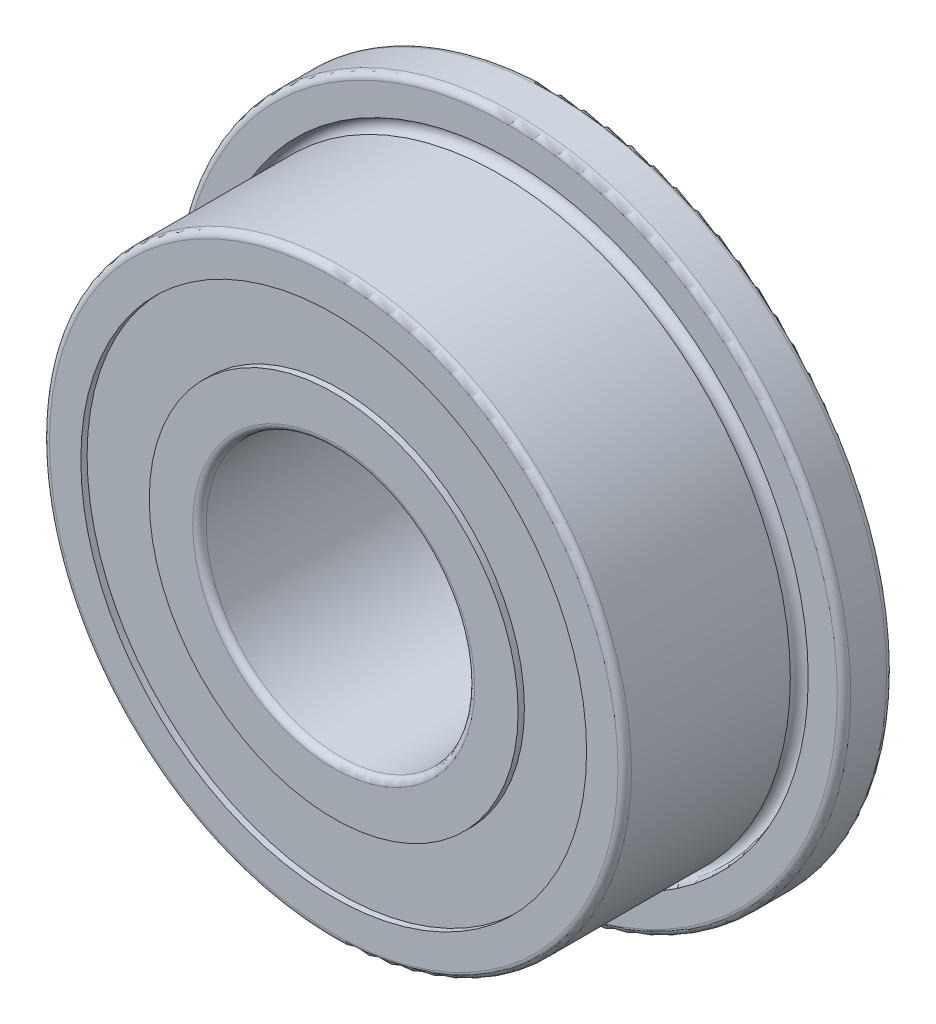
from build123d import *


with BuildPart() as part:
    # Esquisse1 → Révolution1 (revolve)
    with BuildSketch(Plane(origin=(0, 0, 0), x_dir=(0, 0, -1), z_dir=(1, 0, 0))):
        with BuildLine():
            Line((0, 6.35), (0, 5.649))
            Line((0, 5.649), (0.14, 5.649))
            Line((0.14, 5.649), (0.14, 4.12))
            Line((0.14, 4.12), (0, 4.12))
            Line((0, 4.12), (0, 3.15))
            ThreePointArc((0, 3.15), (0.043933983, 3.043933983), (0.15, 3))
            Line((0.15, 3), (4.85, 3))
            ThreePointArc((4.85, 3), (4.956066017, 3.043933983), (5, 3.15))
            Line((5, 3.15), (5, 4.12))
            Line((5, 4.12), (4.86, 4.12))
            Line((4.86, 4.12), (4.86, 5.649))
            Line((4.86, 5.649), (5, 5.649))
            Line((5, 5.649), (5, 7.35))
            ThreePointArc((5, 7.35), (4.956066017, 7.456066017), (4.85, 7.5))
            Line((4.85, 7.5), (4.05, 7.5))
            ThreePointArc((4.05, 7.5), (3.943933983, 7.456066017), (3.9, 7.35))
            Line((3.9, 7.35), (3.9, 6.7))
            ThreePointArc((3.9, 6.7), (4.041421356, 6.358578644), (3.7, 6.5))
            Line((3.7, 6.5), (0.15, 6.5))
            ThreePointArc((0.15, 6.5), (0.043933983, 6.456066017), (0, 6.35))
        make_face()
    revolve(axis=Axis((0, 0, -5), (0, 0, 1)))


solid = part.part
